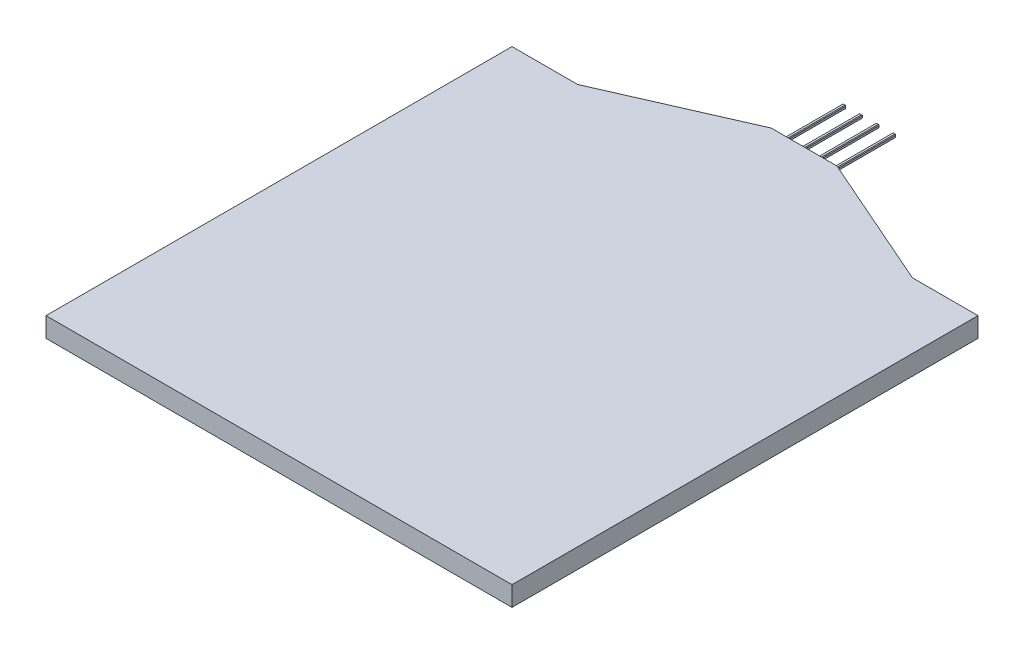
from build123d import *

# Parameters (mm, degrees)
BOSS_EXTRUDE1_DEPTH = 3
SKETCH2_W           = 0.5
SKETCH2_H           = 0.5
BOSS_EXTRUDE2_DEPTH = 10
CHAMFER1_SIZE       = 0.1


with BuildPart() as part:
    # Sketch1 → Boss-Extrude1 (new body)
    with BuildSketch(Plane(origin=(0, 0, 0), x_dir=(1, 0, 0), z_dir=(0, 1, 0))):
        Polygon((-25.5, 35.5), (-35.5, 35.5), (-35.5, -35.5), (35.5, -35.5), (35.5, 35.5), (25.5, 35.5), (5, 44.5), (-5, 44.5), align=None)
    extrude(amount=BOSS_EXTRUDE1_DEPTH)

    # Sketch2 → Boss-Extrude2 (add)
    with BuildSketch(Plane(origin=(0, 0, -44.5), x_dir=(-1, 0, 0), z_dir=(0, 0, -1))):
        with Locations((-3.81, 1.5)):
            Rectangle(SKETCH2_W, SKETCH2_H)
        with Locations((-1.27, 1.5)):
            Rectangle(SKETCH2_W, SKETCH2_H)
        with Locations((1.27, 1.5)):
            Rectangle(SKETCH2_W, SKETCH2_H)
        with Locations((3.81, 1.5)):
            Rectangle(SKETCH2_W, SKETCH2_H)
    extrude(amount=BOSS_EXTRUDE2_DEPTH)

    # Chamfer1
    chamfer1_edges = [part.edges().sort_by_distance(p)[0] for p in [
        (-4.06, 1.5, -44.5),
        (-4.06, 1.25, -49.5),
        (-3.81, 1.25, -44.5),
        (-3.81, 1.25, -54.5),
        (-4.06, 1.5, -54.5),
        (-4.06, 1.75, -49.5),
        (-3.81, 1.75, -54.5),
        (-3.81, 1.75, -44.5),
        (-3.56, 1.75, -49.5),
        (-3.56, 1.5, -54.5),
        (-3.56, 1.25, -49.5),
        (-3.56, 1.5, -44.5),
        (-1.02, 1.5, -44.5),
        (-1.02, 1.75, -49.5),
        (-1.27, 1.75, -44.5),
        (-1.52, 1.75, -49.5),
        (-1.52, 1.5, -44.5),
        (-1.02, 1.25, -49.5),
        (-1.27, 1.25, -44.5),
        (-1.52, 1.25, -49.5),
        (-1.27, 1.25, -54.5),
        (-1.02, 1.5, -54.5),
        (-1.27, 1.75, -54.5),
        (-1.52, 1.5, -54.5),
        (1.27, 1.25, -44.5),
        (1.02, 1.25, -49.5),
        (1.02, 1.5, -44.5),
        (1.27, 1.25, -54.5),
        (1.02, 1.5, -54.5),
        (1.02, 1.75, -49.5),
        (1.27, 1.75, -54.5),
        (1.27, 1.75, -44.5),
        (1.52, 1.75, -49.5),
        (1.52, 1.5, -54.5),
        (1.52, 1.25, -49.5),
        (1.52, 1.5, -44.5),
        (3.81, 1.75, -44.5),
        (3.81, 1.75, -54.5),
        (4.06, 1.75, -49.5),
        (4.06, 1.5, -54.5),
        (4.06, 1.5, -44.5),
        (4.06, 1.25, -49.5),
        (3.81, 1.25, -54.5),
        (3.81, 1.25, -44.5),
        (3.56, 1.25, -49.5),
        (3.56, 1.5, -54.5),
        (3.56, 1.75, -49.5),
        (3.56, 1.5, -44.5),
    ]]
    chamfer(chamfer1_edges, length=CHAMFER1_SIZE)


solid = part.part
